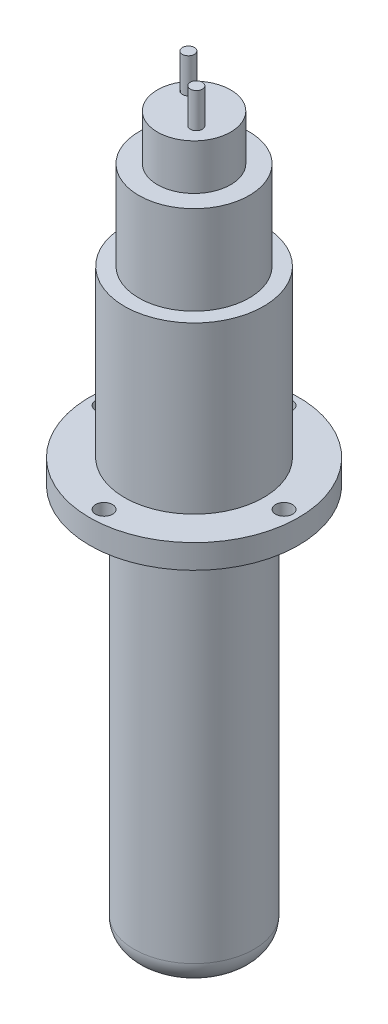
from build123d import *

# Parameters (mm, degrees)
SKETCH1_R           = 22.098
BOSS_EXTRUDE1_DEPTH = 5.08
SKETCH2_R           = 14.732
BOSS_EXTRUDE2_DEPTH = 35.052
SKETCH3_R           = 11.684
BOSS_EXTRUDE3_DEPTH = 18.796
SKETCH4_R           = 7.747
BOSS_EXTRUDE4_DEPTH = 9.652
SKETCH5_R           = 1.27
BOSS_EXTRUDE5_DEPTH = 7.366
SKETCH6_R           = 1.7907
CUT_EXTRUDE1_DEPTH  = 7.366
CIRPATTERN1_COUNT   = 4
SKETCH7_R           = 12.7
BOSS_EXTRUDE6_DEPTH = 83.82
FILLET1_R           = 5.08


with BuildPart() as part:
    # Sketch1 → Boss-Extrude1 (new body)
    with BuildSketch(Plane(origin=(0, 0, 0), x_dir=(1, 0, 0), z_dir=(0, 1, 0))):
        Circle(SKETCH1_R)
    extrude(amount=BOSS_EXTRUDE1_DEPTH)

    # Sketch2 → Boss-Extrude2 (add)
    with BuildSketch(Plane(origin=(0, 5.08, 0), x_dir=(1, 0, 0), z_dir=(0, 1, 0))):
        Circle(SKETCH2_R)
    extrude(amount=BOSS_EXTRUDE2_DEPTH)

    # Sketch3 → Boss-Extrude3 (add)
    with BuildSketch(Plane(origin=(0, 40.132, 0), x_dir=(1, 0, 0), z_dir=(0, 1, 0))):
        Circle(SKETCH3_R)
    extrude(amount=BOSS_EXTRUDE3_DEPTH)

    # Sketch4 → Boss-Extrude4 (add)
    with BuildSketch(Plane(origin=(0, 58.928, 0), x_dir=(1, 0, 0), z_dir=(0, 1, 0))):
        Circle(SKETCH4_R)
    extrude(amount=BOSS_EXTRUDE4_DEPTH)

    # Sketch5 → Boss-Extrude5 (add)
    with BuildSketch(Plane(origin=(0, 68.58, 0), x_dir=(1, 0, 0), z_dir=(0, 1, 0))):
        with Locations((-4.243406318, 3.044398822)):
            Circle(SKETCH5_R)
        with Locations((2.970026773, -2.481757502)):
            Circle(SKETCH5_R)
    extrude(amount=BOSS_EXTRUDE5_DEPTH)

    # Sketch6 → Cut-Extrude1 (cut)
    with BuildSketch(Plane(origin=(0, 5.08, 0), x_dir=(1, 0, 0), z_dir=(0, 1, 0))):
        with Locations((0, 19.05)):
            Circle(SKETCH6_R)
    cut_extrude1 = extrude(amount=-CUT_EXTRUDE1_DEPTH, mode=Mode.SUBTRACT)

    # CirPattern1: Cut-Extrude1 ×4 about axis
    cirpattern1_axis = Axis((0, 5.08, 0), (0, 1, 0))
    for i in range(1, CIRPATTERN1_COUNT):
        add(cut_extrude1.rotate(cirpattern1_axis, i * 360 / CIRPATTERN1_COUNT), mode=Mode.SUBTRACT)

    # Sketch7 → Boss-Extrude6 (add)
    with BuildSketch(Plane(origin=(0, 0, 0), x_dir=(-1, 0, 0), z_dir=(0, -1, 0))):
        Circle(SKETCH7_R)
    extrude(amount=BOSS_EXTRUDE6_DEPTH)

    # Fillet1
    fillet1_edges = [part.edges().sort_by_distance(p)[0] for p in [
        (12.7, -83.82, 0),
    ]]
    fillet(fillet1_edges, radius=FILLET1_R)


solid = part.part
